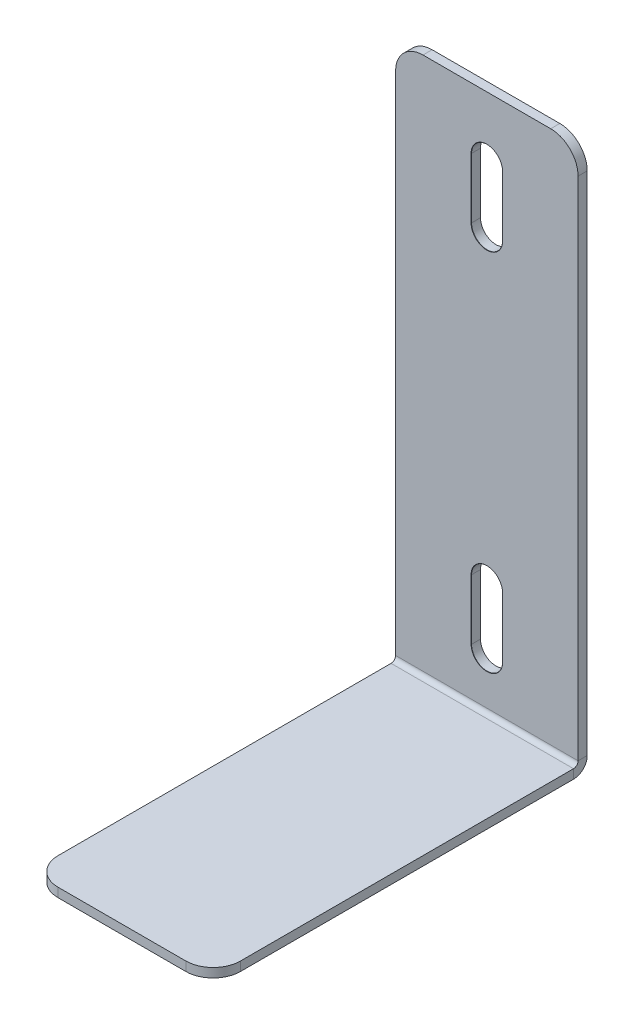
from build123d import *

# Parameters (mm, degrees)
SKETCH1_W                    = 20
SKETCH1_H                    = 60
BASE_FLANGE1_DEPTH           = 1
EDGE_FLANGE1_STRIP_W         = 5
EDGE_FLANGE1_STRIP_H         = 1
EDGE_FLANGE1_STRIP_CUT_DEPTH = 20
EDGE_FLANGE1_DEPTH           = 20
FILLET1_R                    = 3
M3_START                     = -1
M3_CLEARANCE_SLOT4_DEPTH     = 1


with BuildPart() as part:
    # Base-Flange1: sheet metal written as solids
    # Sketch1 → Base-Flange1 (new body)
    with BuildSketch(Plane.XY):
        Rectangle(SKETCH1_W, SKETCH1_H)
    extrude(amount=-BASE_FLANGE1_DEPTH)

    # Edge-Flange1: sheet metal written as solids
    # Edge-Flange1 strip (on a plane across the edge) → Edge-Flange1 strip cut (cut)
    with BuildSketch(Plane(origin=(-10, -30, 0), x_dir=(0, 1, 0), z_dir=(1, 0, 0))):
        with Locations((-1, -0.5)):
            Rectangle(EDGE_FLANGE1_STRIP_W, EDGE_FLANGE1_STRIP_H)
    extrude(amount=EDGE_FLANGE1_STRIP_CUT_DEPTH, mode=Mode.SUBTRACT)

    # Edge-Flange1 section (on a plane across the edge) → Edge-Flange1 (add)
    with BuildSketch(Plane(origin=(-10, -30, 0), x_dir=(0, 1, 0), z_dir=(1, 0, 0))):
        with BuildLine():
            Line((0, 0.5), (0, 40))
            Line((0, 40), (1, 40))
            Line((1, 40), (1, 0.5))
            ThreePointArc((1, 0.5), (1.146446609, 0.146446609), (1.5, 0))
            Line((1.5, 0), (1.5, -1))
            ThreePointArc((1.5, -1), (0.439339828, -0.560660172), (0, 0.5))
        make_face()
    extrude(amount=EDGE_FLANGE1_DEPTH)

    # Fillet1
    fillet1_edges = [part.edges().sort_by_distance(p)[0] for p in [
        (-10, -29.5, 40),
        (10, -29.5, 40),
        (-10, 30, -0.5),
        (10, 30, -0.5),
    ]]
    fillet(fillet1_edges, radius=FILLET1_R)

    # M3 Clearance Slot4: read off the stored shape, not the designer's step
    # M3 Clearance Slot4 outline → M3 Clearance Slot4 (cut)
    with BuildSketch(Plane.XY.offset(M3_START)):
        with BuildLine():
            Line((1.7, -23.3), (1.7, -16.7))
            ThreePointArc((1.7, -16.7), (0, -15), (-1.7, -16.7))
            Line((-1.7, -16.7), (-1.7, -23.3))
            ThreePointArc((-1.7, -23.3), (0, -25), (1.7, -23.3))
        make_face()
        with BuildLine():
            ThreePointArc((1.7, 23.3), (0, 25), (-1.7, 23.3))
            Line((-1.7, 23.3), (-1.7, 16.7))
            ThreePointArc((-1.7, 16.7), (0, 15), (1.7, 16.7))
            Line((1.7, 16.7), (1.7, 23.3))
        make_face()
    extrude(amount=M3_CLEARANCE_SLOT4_DEPTH, mode=Mode.SUBTRACT)

    # M3 Clearance Slot4 2: loft between two sections, ruled curve by curve
    m3_clearance_slot4_2_from = [
        Edge.make_three_point_arc((1.7, -16.7, -0.025), (1.202081528, -15.497918472, -0.025), (0, -15, -0.025)),
        Edge.make_three_point_arc((0, -15, -0.025), (-1.202081528, -15.497918472, -0.025), (-1.7, -16.7, -0.025)),
        Edge.make_three_point_arc((-1.7, -23.3, -0.025), (-1.202081528, -24.502081528, -0.025), (0, -25, -0.025)),
        Edge.make_three_point_arc((0, -25, -0.025), (1.202081528, -24.502081528, -0.025), (1.7, -23.3, -0.025)),
        Edge.make_line((-1.7, -16.7, -0.025), (-1.7, -23.3, -0.025)),
        Edge.make_line((1.7, -16.7, -0.025), (1.7, -23.3, -0.025)),
    ]
    m3_clearance_slot4_2_to = [
        Edge.make_three_point_arc((1.725, -16.7, 0), (1.219759198, -15.480240802, 0), (0, -14.975, 0)),
        Edge.make_three_point_arc((0, -14.975, 0), (-1.219759198, -15.480240802, 0), (-1.725, -16.7, 0)),
        Edge.make_three_point_arc((-1.725, -23.3, 0), (-1.219759198, -24.519759198, 0), (0, -25.025, 0)),
        Edge.make_three_point_arc((0, -25.025, 0), (1.219759198, -24.519759198, 0), (1.725, -23.3, 0)),
        Edge.make_line((-1.725, -16.7, 0), (-1.725, -23.3, 0)),
        Edge.make_line((1.725, -16.7, 0), (1.725, -23.3, 0)),
    ]
    m3_clearance_slot4_2 = Solid(Shell([*[Face.make_surface_from_curves(m3_clearance_slot4_2_from[k], m3_clearance_slot4_2_to[k]) for k in range(6)], Face(Wire(m3_clearance_slot4_2_from)), Face(Wire(m3_clearance_slot4_2_to))]))
    add(m3_clearance_slot4_2, mode=Mode.SUBTRACT)

    # M3 Clearance Slot4 3: loft between two sections, ruled curve by curve
    m3_clearance_slot4_3_from = [
        Edge.make_three_point_arc((1.7, 23.3, -0.025), (1.202081528, 24.502081528, -0.025), (0, 25, -0.025)),
        Edge.make_three_point_arc((0, 25, -0.025), (-1.202081528, 24.502081528, -0.025), (-1.7, 23.3, -0.025)),
        Edge.make_three_point_arc((-1.7, 16.7, -0.025), (-1.202081528, 15.497918472, -0.025), (0, 15, -0.025)),
        Edge.make_three_point_arc((0, 15, -0.025), (1.202081528, 15.497918472, -0.025), (1.7, 16.7, -0.025)),
        Edge.make_line((-1.7, 23.3, -0.025), (-1.7, 16.7, -0.025)),
        Edge.make_line((1.7, 23.3, -0.025), (1.7, 16.7, -0.025)),
    ]
    m3_clearance_slot4_3_to = [
        Edge.make_three_point_arc((1.725, 23.3, 0), (1.219759198, 24.519759198, 0), (0, 25.025, 0)),
        Edge.make_three_point_arc((0, 25.025, 0), (-1.219759198, 24.519759198, 0), (-1.725, 23.3, 0)),
        Edge.make_three_point_arc((-1.725, 16.7, 0), (-1.219759198, 15.480240802, 0), (0, 14.975, 0)),
        Edge.make_three_point_arc((0, 14.975, 0), (1.219759198, 15.480240802, 0), (1.725, 16.7, 0)),
        Edge.make_line((-1.725, 23.3, 0), (-1.725, 16.7, 0)),
        Edge.make_line((1.725, 23.3, 0), (1.725, 16.7, 0)),
    ]
    m3_clearance_slot4_3 = Solid(Shell([*[Face.make_surface_from_curves(m3_clearance_slot4_3_from[k], m3_clearance_slot4_3_to[k]) for k in range(6)], Face(Wire(m3_clearance_slot4_3_from)), Face(Wire(m3_clearance_slot4_3_to))]))
    add(m3_clearance_slot4_3, mode=Mode.SUBTRACT)


solid = part.part
